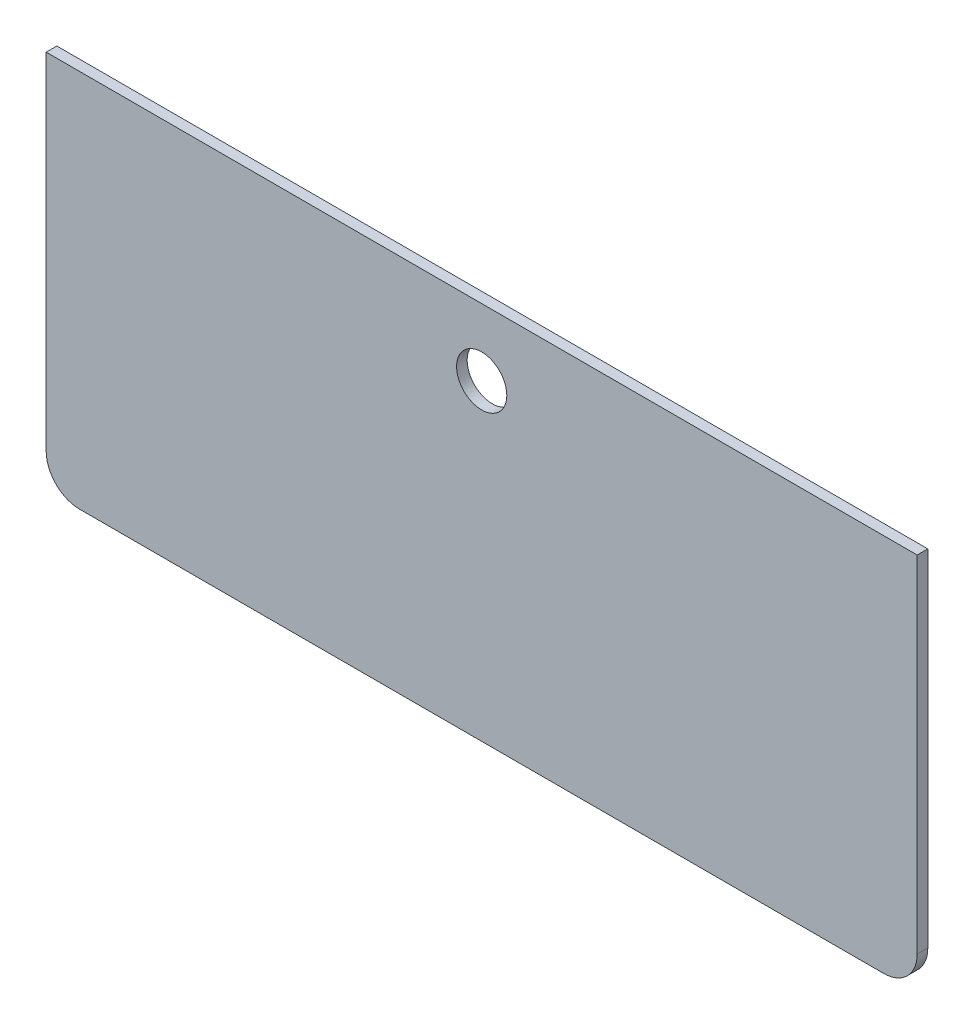
from build123d import *

# Parameters (mm, degrees)
SKETCH1_W           = 260
SKETCH1_H           = 113.175
SKETCH1_R           = 7.5
BOSS_EXTRUDE1_DEPTH = 3.175
FILLET1_R           = 10


with BuildPart() as part:
    # Sketch1 → Boss-Extrude1 (new body)
    with BuildSketch(Plane.XY):
        with Locations((-26.765375854, -29.400711845)):
            Rectangle(SKETCH1_W, SKETCH1_H)
        with Locations((-26.765375854, 7.186788155)):
            Circle(SKETCH1_R, mode=Mode.SUBTRACT)
    extrude(amount=BOSS_EXTRUDE1_DEPTH)

    # Fillet1
    fillet1_edges = [part.edges().sort_by_distance(p)[0] for p in [
        (-156.765375854, -85.988211845, 1.5875),
        (103.234624146, -85.988211845, 1.5875),
    ]]
    fillet(fillet1_edges, radius=FILLET1_R)


solid = part.part
